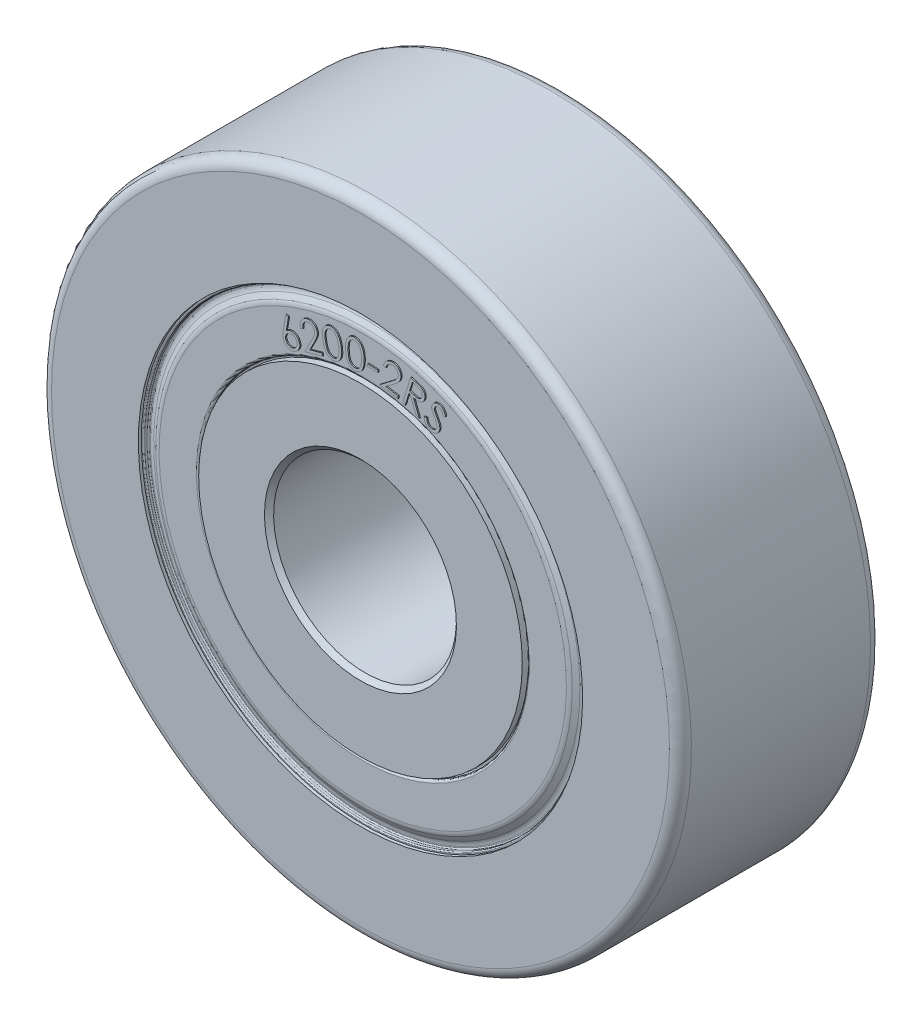
from build123d import *

# Parameters (mm, degrees)
WRAP1_DEPTH = 0.0625


# Read off the part's stored shape, not the designer's step: Wrap1
with BuildPart() as part:
    # Shield_RevolverSketch → ShieldsORseals (revolve)
    with BuildSketch(Plane(origin=(0, 0, 0), x_dir=(0, 0, -1), z_dir=(1, 0, 0))):
        with BuildLine():
            Line((-0.163675135, 12.15), (-10.836324865, 12.15))
            Line((-10.836324865, 12.15), (-10.836324865, 12.0875))
            ThreePointArc((-10.836324865, 12.0875), (-10.818019039, 12.043305826), (-10.773824865, 12.025))
            Line((-10.773824865, 12.025), (-10.648824865, 12.025))
            ThreePointArc((-10.648824865, 12.025), (-10.604630692, 12.006694174), (-10.586324865, 11.9625))
            Line((-10.586324865, 11.9625), (-10.586324865, 11.908974596))
            ThreePointArc((-10.586324865, 11.908974596), (-10.603361952, 11.779565074), (-10.653312164, 11.658974596))
            Line((-10.653312164, 11.658974596), (-10.808012702, 11.391025404))
            ThreePointArc((-10.808012702, 11.391025404), (-10.857962913, 11.270434926), (-10.875, 11.141025404))
            Line((-10.875, 11.141025404), (-10.875, 9.1))
            ThreePointArc((-10.875, 9.1), (-10.838388348, 9.011611652), (-10.75, 8.975))
            Line((-10.75, 8.975), (-10.6875, 8.975))
            ThreePointArc((-10.6875, 8.975), (-10.643305826, 8.956694174), (-10.625, 8.9125))
            Line((-10.625, 8.9125), (-10.625, 8.85))
            Line((-10.625, 8.85), (-0.375, 8.85))
            Line((-0.375, 8.85), (-0.375, 8.9125))
            ThreePointArc((-0.375, 8.9125), (-0.356694174, 8.956694174), (-0.3125, 8.975))
            Line((-0.3125, 8.975), (-0.25, 8.975))
            ThreePointArc((-0.25, 8.975), (-0.161611652, 9.011611652), (-0.125, 9.1))
            Line((-0.125, 9.1), (-0.125, 11.141025404))
            ThreePointArc((-0.125, 11.141025404), (-0.142037087, 11.270434926), (-0.191987298, 11.391025404))
            Line((-0.191987298, 11.391025404), (-0.346687836, 11.658974596))
            ThreePointArc((-0.346687836, 11.658974596), (-0.396638048, 11.779565074), (-0.413675135, 11.908974596))
            Line((-0.413675135, 11.908974596), (-0.413675135, 11.9625))
            ThreePointArc((-0.413675135, 11.9625), (-0.395369308, 12.006694174), (-0.351175135, 12.025))
            Line((-0.351175135, 12.025), (-0.226175135, 12.025))
            ThreePointArc((-0.226175135, 12.025), (-0.181980961, 12.043305826), (-0.163675135, 12.0875))
            Line((-0.163675135, 12.0875), (-0.163675135, 12.15))
        make_face()
    revolve(axis=Axis((0, 0, 0), (0, 0, 1)))

    # ProfileRevolveSketch → InnerANDouterRaces (revolve)
    with BuildSketch(Plane(origin=(0, 0, 0), x_dir=(0, 0, -1), z_dir=(1, 0, 0))):
        Polygon((0, 5.25), (0, 8.85), (-11, 8.85), (-11, 5.25), (-10.75, 5), (-0.25, 5), align=None)
        with BuildLine():
            Line((0, 16.9), (0, 12.15))
            Line((0, 12.15), (-11, 12.15))
            Line((-11, 12.15), (-11, 16.9))
            ThreePointArc((-11, 16.9), (-10.824264069, 17.324264069), (-10.4, 17.5))
            Line((-10.4, 17.5), (-0.6, 17.5))
            ThreePointArc((-0.6, 17.5), (-0.175735931, 17.324264069), (0, 16.9))
        make_face()
    revolve(axis=Axis((0, 0, 0), (0, 0, 1)))

    # Wrap1 outline → Wrap1 (add)
    # profile 1 of 8: a face of its own
    with BuildSketch(Plane.XY.offset(10.875)):
        with BuildLine():
            add(Edge.make_bspline(
                [(-4.119017386, 9.239939902), (-4.108541975, 9.249130369), (-4.088091496, 9.267072334), (-4.055801866, 9.290378365), (-4.023646891, 9.3106551), (-4.001340094, 9.321275332), (-3.990411617, 9.326478363)],
                knots=[0, 0, 0, 0, 0.268479265, 0.524135005, 0.76686569, 1, 1, 1, 1], degree=3))
            Line((-4.119017386, 9.239939902), (-3.996721713, 9.962295671))
            Line((-3.996721713, 9.962295671), (-4.141553443, 9.985733171))
            Line((-4.141553443, 9.985733171), (-4.283079886, 9.184050479))
            add(Edge.make_bspline(
                [(-4.262647193, 8.716802883), (-4.268465026, 8.731119106), (-4.280307463, 8.760260367), (-4.292560162, 8.806919743), (-4.301584618, 8.856339174), (-4.306052203, 8.89970612), (-4.307649663, 8.936440824), (-4.307592032, 8.966213451), (-4.306381974, 8.997885143), (-4.303823476, 9.031431011), (-4.300736213, 9.066944408), (-4.295617099, 9.104253744), (-4.290109079, 9.143566531), (-4.285460344, 9.170340466), (-4.283079886, 9.184050479)],
                knots=[0, 0, 0, 0, 0.097579587, 0.198627263, 0.304167428, 0.414903045, 0.47382958, 0.536499886, 0.603016605, 0.674096982, 0.749118783, 0.82826568, 0.912060748, 1, 1, 1, 1], degree=3))
            add(Edge.make_bspline(
                [(-3.66348854, 8.48152644), (-3.682244499, 8.473982697), (-3.719331193, 8.459066239), (-3.777798344, 8.446111896), (-3.836936919, 8.440209856), (-3.896453227, 8.442396392), (-3.955031206, 8.452135918), (-4.011392195, 8.470133646), (-4.065221626, 8.495545085), (-4.115350519, 8.528937494), (-4.161050724, 8.568526492), (-4.201828745, 8.612880142), (-4.236164814, 8.662496331), (-4.253782278, 8.698623889), (-4.262647193, 8.716802883)],
                knots=[0, 0, 0, 0, 0.084484254, 0.167053121, 0.249597513, 0.332646988, 0.415549289, 0.497345244, 0.579471351, 0.663876535, 0.748580962, 0.831959841, 0.915444023, 1, 1, 1, 1], degree=3))
            add(Edge.make_bspline(
                [(-3.42160152, 9.09090144), (-3.413794969, 9.071337992), (-3.398462834, 9.032915211), (-3.384226559, 8.97308677), (-3.378482917, 8.913030689), (-3.380875474, 8.853182034), (-3.391326524, 8.794506023), (-3.410055989, 8.73787444), (-3.436222623, 8.683425851), (-3.470631705, 8.63241958), (-3.510901998, 8.585425243), (-3.556607517, 8.543902079), (-3.607407191, 8.5084104), (-3.644679911, 8.490542814), (-3.66348854, 8.48152644)],
                knots=[0, 0, 0, 0, 0.086348144, 0.169588498, 0.251341229, 0.333197208, 0.414623848, 0.495076882, 0.577245943, 0.661714138, 0.746816905, 0.830615492, 0.914524877, 1, 1, 1, 1], degree=3))
            add(Edge.make_bspline(
                [(-3.990411617, 9.326478363), (-3.976986426, 9.331955464), (-3.950457086, 9.342778689), (-3.909452858, 9.354156277), (-3.868360688, 9.361106446), (-3.827182828, 9.363831115), (-3.785881704, 9.362384275), (-3.74447542, 9.35630767), (-3.703169635, 9.345602472), (-3.662211754, 9.330970979), (-3.622696324, 9.31253086), (-3.585260168, 9.290758749), (-3.550798732, 9.265499069), (-3.518964692, 9.23713988), (-3.490281936, 9.205308126), (-3.464500931, 9.170295156), (-3.440966892, 9.132230918), (-3.428144237, 9.104864873), (-3.42160152, 9.09090144)],
                knots=[0, 0, 0, 0, 0.06337709, 0.125238616, 0.185664134, 0.245373965, 0.305431523, 0.36608529, 0.428030524, 0.491771466, 0.556056566, 0.618494006, 0.680882246, 0.742621107, 0.804653029, 0.867913426, 0.932603269, 1, 1, 1, 1], degree=3))
        make_face()
        with BuildLine():
            add(Edge.make_bspline(
                [(-4.130435655, 8.777199517), (-4.125898776, 8.767596793), (-4.116942445, 8.748639885), (-4.100693458, 8.72203098), (-4.081853569, 8.698026827), (-4.061359565, 8.675768532), (-4.038459019, 8.655958433), (-4.013393573, 8.638420421), (-3.986118134, 8.623413461), (-3.957193696, 8.610568998), (-3.927147516, 8.600361768), (-3.896712887, 8.593500058), (-3.86643414, 8.589489743), (-3.836238543, 8.588621236), (-3.806004919, 8.590630648), (-3.775949486, 8.596211303), (-3.745862007, 8.604507423), (-3.726511622, 8.612618838), (-3.716673636, 8.616742787)],
                knots=[0, 0, 0, 0, 0.064495797, 0.127322289, 0.188910699, 0.249618039, 0.310868843, 0.372484302, 0.435133734, 0.499698388, 0.564546303, 0.627578736, 0.688941276, 0.74981916, 0.810818569, 0.872646997, 0.935252086, 1, 1, 1, 1], degree=3))
            add(Edge.make_bspline(
                [(-3.970279405, 9.19216346), (-3.979903574, 9.187659002), (-3.998950624, 9.178744296), (-4.025238567, 9.162023481), (-4.049670286, 9.143644442), (-4.071593959, 9.122755928), (-4.091529153, 9.099902906), (-4.109146753, 9.074766357), (-4.123979191, 9.047298872), (-4.136930526, 9.018328982), (-4.147055192, 8.988360057), (-4.15405999, 8.957953445), (-4.157933108, 8.927658775), (-4.158971283, 8.897351126), (-4.156442293, 8.86714576), (-4.15095775, 8.836984695), (-4.142670482, 8.806692556), (-4.134558615, 8.787138245), (-4.130435655, 8.777199517)],
                knots=[0, 0, 0, 0, 0.064360214, 0.127374345, 0.1884632, 0.249458427, 0.310580469, 0.372066399, 0.43511563, 0.499544555, 0.564256147, 0.62656415, 0.688399902, 0.749149808, 0.810066398, 0.871764849, 0.934822851, 1, 1, 1, 1], degree=3))
            add(Edge.make_bspline(
                [(-3.555916424, 9.030504806), (-3.560555027, 9.040208916), (-3.569655731, 9.059247892), (-3.5860633, 9.08598852), (-3.604681549, 9.11036553), (-3.625613024, 9.132428251), (-3.648480651, 9.152352911), (-3.673612694, 9.169975599), (-3.701083533, 9.184798023), (-3.730044409, 9.197785135), (-3.760067579, 9.20778477), (-3.79028425, 9.215243606), (-3.820526709, 9.21908199), (-3.850712846, 9.219994755), (-3.880946928, 9.217968115), (-3.911010145, 9.212412455), (-3.941030146, 9.204041453), (-3.960431866, 9.196162501), (-3.970279405, 9.19216346)],
                knots=[0, 0, 0, 0, 0.065209084, 0.127936942, 0.189909996, 0.250937757, 0.312092402, 0.373611129, 0.436693989, 0.501157281, 0.56590339, 0.628383614, 0.689649819, 0.750432129, 0.811335773, 0.873067135, 0.935573938, 1, 1, 1, 1], degree=3))
            add(Edge.make_bspline(
                [(-3.716673636, 8.616742787), (-3.70707133, 8.621280027), (-3.68811525, 8.630237072), (-3.661500302, 8.646480847), (-3.637518444, 8.665339964), (-3.615226425, 8.685718981), (-3.595758024, 8.708826749), (-3.578176046, 8.733769736), (-3.563200392, 8.761066167), (-3.550312982, 8.789976805), (-3.540238033, 8.820078029), (-3.53287672, 8.85041963), (-3.52899051, 8.880750319), (-3.528087104, 8.910938726), (-3.530111231, 8.941172198), (-3.535667575, 8.971235581), (-3.544038393, 9.001255538), (-3.55191737, 9.020657263), (-3.555916424, 9.030504806)],
                knots=[0, 0, 0, 0, 0.064526764, 0.127383421, 0.189001401, 0.24973789, 0.310620658, 0.3722657, 0.434945212, 0.499540866, 0.564419917, 0.627620577, 0.68901258, 0.749919694, 0.810948391, 0.872806505, 0.935441652, 1, 1, 1, 1], degree=3))
        make_face(mode=Mode.SUBTRACT)
    # profile 2 of 8: a face of its own
    with BuildSketch(Plane.XY.offset(10.875)):
        with BuildLine():
            add(Edge.make_bspline(
                [(-3.346730427, 9.746912009), (-3.350629817, 9.764485943), (-3.358290396, 9.799010967), (-3.364580499, 9.850905718), (-3.366170046, 9.901597198), (-3.362948997, 9.951035894), (-3.35463875, 9.999195689), (-3.34215358, 10.046178465), (-3.324524965, 10.091857785), (-3.302326568, 10.135741041), (-3.276384483, 10.177365873), (-3.246900172, 10.215624803), (-3.214210832, 10.25019628), (-3.178242712, 10.280985405), (-3.139098204, 10.3081218), (-3.096637308, 10.331293057), (-3.051237657, 10.351077569), (-3.019219529, 10.360714307), (-3.002980427, 10.365601912)],
                knots=[0, 0, 0, 0, 0.068457554, 0.13448887, 0.19853752, 0.26117395, 0.322631977, 0.384196242, 0.445837119, 0.508552326, 0.571041364, 0.632171259, 0.692013104, 0.751739571, 0.811992539, 0.872879646, 0.935526509, 1, 1, 1, 1], degree=3))
            Line((-3.346730427, 9.746912009), (-3.209110234, 9.784772585))
            add(Edge.make_bspline(
                [(-2.97293235, 10.226779797), (-2.984126211, 10.223388152), (-3.006064282, 10.216741101), (-3.037180465, 10.203275582), (-3.06629469, 10.187714178), (-3.092936218, 10.169289292), (-3.117630649, 10.148808702), (-3.139689534, 10.125405151), (-3.159373271, 10.099478729), (-3.177299286, 10.0716546), (-3.191963582, 10.041453299), (-3.203688598, 10.009528551), (-3.212383997, 9.976011775), (-3.218195752, 9.94092287), (-3.220428558, 9.904093577), (-3.219763202, 9.865628987), (-3.216209725, 9.825542145), (-3.211512269, 9.798566516), (-3.209110234, 9.784772585)],
                knots=[0, 0, 0, 0, 0.062862032, 0.123198936, 0.182013628, 0.24013843, 0.297110984, 0.354269154, 0.412667909, 0.471998421, 0.531988032, 0.592832622, 0.654635492, 0.717957484, 0.78382014, 0.852782271, 0.924720526, 1, 1, 1, 1], degree=3))
            add(Edge.make_bspline(
                [(-2.579603023, 10.01704422), (-2.58260272, 10.02693397), (-2.588494774, 10.046359584), (-2.600806868, 10.07400449), (-2.615371668, 10.099943799), (-2.63314943, 10.123761564), (-2.652860234, 10.146095481), (-2.675377705, 10.16638991), (-2.700417272, 10.184687067), (-2.727578071, 10.201039108), (-2.756116303, 10.215233531), (-2.785752661, 10.225871643), (-2.815609418, 10.234271524), (-2.84616396, 10.239098949), (-2.877273561, 10.240386333), (-2.908871913, 10.239364994), (-2.940972457, 10.234766627), (-2.962155928, 10.229472843), (-2.97293235, 10.226779797)],
                knots=[0, 0, 0, 0, 0.062477408, 0.122719172, 0.182704327, 0.242098784, 0.302190993, 0.362688278, 0.425112756, 0.489552191, 0.554329863, 0.617601705, 0.679790397, 0.741763149, 0.80425819, 0.867937953, 0.932817602, 1, 1, 1, 1], degree=3))
            add(Edge.make_bspline(
                [(-2.72293235, 9.495710085), (-2.713580812, 9.513820304), (-2.695597607, 9.548646639), (-2.67030608, 9.599058732), (-2.648015099, 9.64561872), (-2.628762942, 9.688335182), (-2.612285416, 9.727026023), (-2.598198754, 9.761656197), (-2.587309312, 9.792528046), (-2.576935354, 9.828330832), (-2.568349577, 9.870374928), (-2.564940364, 9.920083333), (-2.568415681, 9.969280829), (-2.575866866, 10.001093021), (-2.579603023, 10.01704422)],
                knots=[0, 0, 0, 0, 0.110286024, 0.212082361, 0.30516876, 0.389582524, 0.465584674, 0.532711281, 0.591844642, 0.642615695, 0.734341658, 0.823422933, 0.911461122, 1, 1, 1, 1], degree=3))
            Line((-2.72293235, 9.495710085), (-3.107547734, 8.750818259))
            Line((-3.107547734, 8.750818259), (-2.131886677, 9.021250951))
            Line((-2.131886677, 9.021250951), (-2.170348215, 9.160073066))
            Line((-2.170348215, 9.160073066), (-2.833509273, 8.976178835))
            Line((-2.833509273, 8.976178835), (-2.582908311, 9.460854316))
            add(Edge.make_bspline(
                [(-2.440480427, 10.058811047), (-2.435629487, 10.038574054), (-2.425992997, 9.998372858), (-2.421214365, 9.936565703), (-2.423903164, 9.874716278), (-2.432760789, 9.822817723), (-2.444509451, 9.779834187), (-2.45600014, 9.744066207), (-2.470202133, 9.705006303), (-2.487126045, 9.66251715), (-2.506841357, 9.61666681), (-2.53004235, 9.567739487), (-2.554949347, 9.515088295), (-2.573383709, 9.47932986), (-2.582908311, 9.460854316)],
                knots=[0, 0, 0, 0, 0.098850434, 0.196368386, 0.293644017, 0.392714598, 0.445985923, 0.505495044, 0.571347296, 0.643620285, 0.722998347, 0.808673567, 0.901146123, 1, 1, 1, 1], degree=3))
            add(Edge.make_bspline(
                [(-3.002980427, 10.365601912), (-2.986715027, 10.369694001), (-2.95493307, 10.377689783), (-2.907047099, 10.384649097), (-2.860437905, 10.386864863), (-2.815022215, 10.384115142), (-2.770919552, 10.376877949), (-2.72802877, 10.365217808), (-2.686459352, 10.348435463), (-2.646712609, 10.32713553), (-2.60897008, 10.302779652), (-2.574594625, 10.275237353), (-2.543483034, 10.245399192), (-2.515677487, 10.213194461), (-2.491467466, 10.178317157), (-2.470725221, 10.140987428), (-2.453358664, 10.101030183), (-2.444817354, 10.073028935), (-2.440480427, 10.058811047)],
                knots=[0, 0, 0, 0, 0.070287779, 0.137339586, 0.202498546, 0.265604683, 0.327740603, 0.389582061, 0.451578749, 0.515263522, 0.578396203, 0.63965313, 0.699649022, 0.758909938, 0.81774075, 0.877334045, 0.937715248, 1, 1, 1, 1], degree=3))
        make_face()
    # profile 3 of 8: a face of its own
    with BuildSketch(Plane.XY.offset(10.875)):
        with BuildLine():
            add(Edge.make_bspline(
                [(-1.755683856, 10.656285863), (-1.7438866, 10.65806529), (-1.720576299, 10.661581276), (-1.685491425, 10.663731953), (-1.650846237, 10.662644236), (-1.616569903, 10.659496583), (-1.582724909, 10.653369924), (-1.549203391, 10.644727862), (-1.516262912, 10.632848301), (-1.483671039, 10.618737481), (-1.451778334, 10.602000937), (-1.420966685, 10.5820006), (-1.391402004, 10.558990973), (-1.36217287, 10.533929176), (-1.335140292, 10.505029716), (-1.308437868, 10.474027455), (-1.282909102, 10.440021972), (-1.258621041, 10.402942026), (-1.235152088, 10.362717736), (-1.213683982, 10.318585413), (-1.193945128, 10.270508888), (-1.175267844, 10.218815154), (-1.158247654, 10.163132124), (-1.1425773, 10.103619498), (-1.128895671, 10.040094872), (-1.120944393, 9.996353448), (-1.116861741, 9.973894036)],
                knots=[0, 0, 0, 0, 0.034102655, 0.067383732, 0.100329197, 0.133128705, 0.1657112, 0.198566922, 0.231990626, 0.265722096, 0.300054853, 0.334847963, 0.370591044, 0.4071228, 0.44479738, 0.483594868, 0.52408973, 0.566267135, 0.610279189, 0.65715629, 0.706458592, 0.758819271, 0.814258235, 0.872885352, 0.934731888, 1, 1, 1, 1], degree=3))
            add(Edge.make_bspline(
                [(-2.116260779, 9.803220959), (-2.120119772, 9.826735853), (-2.127608449, 9.872368343), (-2.13598606, 9.939118914), (-2.141849231, 10.002050152), (-2.144805774, 10.061298451), (-2.145606604, 10.116739926), (-2.143562996, 10.168405881), (-2.138870797, 10.216290187), (-2.13137013, 10.26076104), (-2.121218253, 10.302202718), (-2.109635522, 10.341410694), (-2.095794389, 10.378466182), (-2.079906652, 10.413300429), (-2.062025242, 10.446030435), (-2.042343914, 10.476722054), (-2.020142904, 10.505116894), (-1.996264145, 10.531465303), (-1.970661665, 10.555475226), (-1.943859347, 10.577341973), (-1.915437682, 10.596432009), (-1.886185792, 10.613840827), (-1.855172257, 10.627786215), (-1.823321627, 10.639919669), (-1.79007998, 10.649689579), (-1.76724494, 10.654068747), (-1.755683856, 10.656285863)],
                knots=[0, 0, 0, 0, 0.068601712, 0.133126989, 0.193644809, 0.250526801, 0.303878329, 0.353230861, 0.39931322, 0.44231224, 0.482948854, 0.52208755, 0.559956334, 0.596733376, 0.632221611, 0.66725587, 0.701576721, 0.735872121, 0.769532424, 0.802544153, 0.835337263, 0.868030055, 0.900416177, 0.933087342, 0.966122993, 1, 1, 1, 1], degree=3))
            add(Edge.make_bspline(
                [(-1.493063664, 9.118425286), (-1.504663852, 9.116771228), (-1.527690377, 9.113487901), (-1.562251154, 9.11127151), (-1.596304283, 9.112345339), (-1.629965109, 9.115582224), (-1.663244961, 9.121558984), (-1.696036644, 9.130401991), (-1.728482539, 9.141478729), (-1.760215038, 9.155626987), (-1.791238943, 9.172534545), (-1.821303737, 9.191960228), (-1.849978534, 9.214481237), (-1.877650503, 9.239512448), (-1.904450911, 9.267052974), (-1.929663606, 9.29771151), (-1.954041095, 9.330743939), (-1.977382397, 9.36677536), (-1.999468352, 9.406470329), (-2.020132255, 9.450340716), (-2.039225176, 9.498730296), (-2.057520875, 9.551110198), (-2.074458976, 9.607939888), (-2.089406104, 9.669221388), (-2.10410441, 9.73465705), (-2.112134452, 9.779947799), (-2.116260779, 9.803220959)],
                knots=[0, 0, 0, 0, 0.033758538, 0.067011139, 0.099636562, 0.131830181, 0.164382755, 0.196936609, 0.229613057, 0.263079157, 0.296916565, 0.331339733, 0.366095245, 0.401857207, 0.438801548, 0.476716225, 0.516143083, 0.557051689, 0.600334896, 0.646942151, 0.696678475, 0.750167267, 0.806783666, 0.867473974, 0.931900014, 1, 1, 1, 1], degree=3))
            add(Edge.make_bspline(
                [(-1.116861741, 9.973894036), (-1.113194017, 9.951481932), (-1.106038855, 9.907759382), (-1.098291599, 9.843502332), (-1.093063531, 9.782367908), (-1.090617357, 9.724421394), (-1.090781832, 9.669660168), (-1.093881746, 9.61812468), (-1.098956795, 9.569585524), (-1.10758252, 9.524198236), (-1.118086726, 9.481448216), (-1.130800471, 9.441169661), (-1.145047491, 9.402912864), (-1.161701323, 9.367000451), (-1.180226326, 9.33325708), (-1.201139788, 9.301961454), (-1.223670478, 9.272598194), (-1.248308414, 9.245679197), (-1.274381335, 9.221022577), (-1.301908478, 9.198898502), (-1.330757364, 9.179489859), (-1.360681878, 9.162118088), (-1.391983672, 9.14743842), (-1.424537293, 9.135136038), (-1.458230137, 9.124985401), (-1.481396799, 9.120622479), (-1.493063664, 9.118425286)],
                knots=[0, 0, 0, 0, 0.064964172, 0.126735055, 0.185106669, 0.240456744, 0.292608155, 0.341690531, 0.388111202, 0.432116611, 0.473745143, 0.513983624, 0.552886897, 0.590451216, 0.627133055, 0.662895734, 0.698029556, 0.732917134, 0.767174173, 0.800602696, 0.833823024, 0.866556594, 0.899498944, 0.932600424, 0.966057181, 1, 1, 1, 1], degree=3))
        make_face()
        with BuildLine():
            add(Edge.make_bspline(
                [(-1.510792029, 9.251838748), (-1.494790343, 9.255383941), (-1.462992478, 9.262428798), (-1.41809344, 9.283126487), (-1.376172346, 9.310949408), (-1.344856946, 9.340652375), (-1.321246666, 9.367326733), (-1.305567803, 9.390044748), (-1.290832779, 9.414144385), (-1.278458488, 9.44036717), (-1.267251181, 9.468135129), (-1.257554521, 9.497708619), (-1.249863818, 9.529190047), (-1.24595393, 9.550894567), (-1.243965106, 9.561934902)],
                knots=[0, 0, 0, 0, 0.111975071, 0.222512065, 0.336286055, 0.45520674, 0.516964281, 0.579962791, 0.643961753, 0.710232843, 0.778255956, 0.848975469, 0.923179069, 1, 1, 1, 1], degree=3))
            add(Edge.make_bspline(
                [(-1.977138183, 9.823954132), (-1.973652902, 9.803899533), (-1.966908206, 9.765089986), (-1.955143763, 9.709079666), (-1.942569011, 9.657183998), (-1.929367222, 9.609273297), (-1.91558461, 9.56535651), (-1.901261235, 9.525271992), (-1.886098599, 9.489157364), (-1.869632786, 9.456934762), (-1.85242134, 9.427856443), (-1.834195913, 9.401283593), (-1.815470029, 9.376602929), (-1.79538568, 9.354196627), (-1.774533478, 9.333754916), (-1.752432454, 9.315678962), (-1.729503636, 9.299573346), (-1.697965565, 9.28152932), (-1.657537406, 9.264262013), (-1.608433843, 9.250834941), (-1.559113126, 9.246244201), (-1.526896285, 9.249974221), (-1.510792029, 9.251838748)],
                knots=[0, 0, 0, 0, 0.074004831, 0.143213726, 0.208045477, 0.268124962, 0.323870583, 0.375363211, 0.422846776, 0.466169423, 0.506828004, 0.545615272, 0.583273151, 0.619383112, 0.654922976, 0.689334784, 0.723077204, 0.756683752, 0.821285988, 0.882324669, 0.941177549, 1, 1, 1, 1], degree=3))
            add(Edge.make_bspline(
                [(-1.727138183, 10.518064709), (-1.74303768, 10.514514483), (-1.774855683, 10.507409786), (-1.819811588, 10.486554592), (-1.861856928, 10.458124951), (-1.893688039, 10.428331006), (-1.917156464, 10.4009978), (-1.933397291, 10.378352847), (-1.948101301, 10.354060319), (-1.961156286, 10.327928378), (-1.97232644, 10.300115035), (-1.982533907, 10.270723881), (-1.990372174, 10.239502746), (-1.997197692, 10.206359416), (-2.001994237, 10.170629605), (-2.004598944, 10.131591144), (-2.005139015, 10.08906484), (-2.003413548, 10.042868358), (-2.000311115, 9.993125209), (-1.994251147, 9.939867581), (-1.986914123, 9.883022715), (-1.980467078, 9.844068115), (-1.977138183, 9.823954132)],
                knots=[0, 0, 0, 0, 0.059113875, 0.118298428, 0.178923044, 0.243107793, 0.276181304, 0.309849384, 0.344337262, 0.379365432, 0.415964846, 0.453291347, 0.492434965, 0.532944854, 0.576326109, 0.623435567, 0.675171873, 0.730940147, 0.791547247, 0.856399507, 0.925852715, 1, 1, 1, 1], degree=3))
            add(Edge.make_bspline(
                [(-1.253580491, 9.947451729), (-1.256767409, 9.96540306), (-1.263000533, 10.000513116), (-1.274134942, 10.051627373), (-1.286509402, 10.099991357), (-1.299558465, 10.14567824), (-1.31400139, 10.188494055), (-1.329671844, 10.228445697), (-1.346087643, 10.265855766), (-1.363842704, 10.300419806), (-1.382484189, 10.332262878), (-1.401721282, 10.361648207), (-1.421933344, 10.388324802), (-1.442526837, 10.41297424), (-1.46451198, 10.434407224), (-1.486897686, 10.453614358), (-1.510016318, 10.470306075), (-1.541700616, 10.488172345), (-1.58151083, 10.506252761), (-1.630479327, 10.518797527), (-1.679305507, 10.524177519), (-1.711230051, 10.5200977), (-1.727138183, 10.518064709)],
                knots=[0, 0, 0, 0, 0.066330546, 0.12973239, 0.190276671, 0.247942696, 0.302566892, 0.354607626, 0.404041377, 0.451143349, 0.49589443, 0.538244111, 0.578840625, 0.617616752, 0.654981855, 0.690398208, 0.724881713, 0.758511233, 0.822634754, 0.883269996, 0.941832956, 1, 1, 1, 1], degree=3))
            add(Edge.make_bspline(
                [(-1.243965106, 9.561934902), (-1.2418084, 9.576037892), (-1.237431892, 9.604656455), (-1.233646149, 9.648708994), (-1.23198766, 9.694327643), (-1.231788829, 9.741654131), (-1.234476974, 9.790654956), (-1.23859539, 9.841476809), (-1.244871019, 9.894007347), (-1.250645599, 9.929442197), (-1.253580491, 9.947451729)],
                knots=[0, 0, 0, 0, 0.11045612, 0.224143636, 0.342128631, 0.463899877, 0.590476978, 0.722004576, 0.858710637, 1, 1, 1, 1], degree=3))
        make_face(mode=Mode.SUBTRACT)
    # profile 4 of 8: a face of its own
    with BuildSketch(Plane.XY.offset(10.875)):
        with BuildLine():
            add(Edge.make_bspline(
                [(-0.403103844, 10.792389239), (-0.391180971, 10.792453982), (-0.367501394, 10.792582566), (-0.332325777, 10.789869713), (-0.297870486, 10.784419518), (-0.264270662, 10.776396774), (-0.231465728, 10.76536781), (-0.199448736, 10.751868819), (-0.168030647, 10.735940722), (-0.137635033, 10.717185089), (-0.108159156, 10.695964197), (-0.080274276, 10.671780243), (-0.053549749, 10.645253506), (-0.028782965, 10.615706926), (-0.005162692, 10.583615785), (0.016996762, 10.548921789), (0.037360432, 10.511333788), (0.056861201, 10.471306497), (0.074122561, 10.427871279), (0.090013678, 10.381144918), (0.102877281, 10.330521946), (0.114422787, 10.276423933), (0.123501703, 10.21862029), (0.131196523, 10.157219083), (0.136079516, 10.092127609), (0.137987033, 10.047503377), (0.138963464, 10.024660874)],
                knots=[0, 0, 0, 0, 0.033911858, 0.067351088, 0.100239387, 0.13306961, 0.165510428, 0.1985883, 0.231851004, 0.26562249, 0.300107788, 0.335065509, 0.370529448, 0.407125912, 0.444628672, 0.483837833, 0.524137763, 0.566197647, 0.610435885, 0.657024591, 0.706513168, 0.758937165, 0.814358728, 0.872926188, 0.934952742, 1, 1, 1, 1], degree=3))
            add(Edge.make_bspline(
                [(-0.879365863, 9.992509431), (-0.879929048, 10.016446865), (-0.881022402, 10.062918387), (-0.879939072, 10.130553484), (-0.87755368, 10.194018619), (-0.872368018, 10.253358028), (-0.865293057, 10.308623079), (-0.856052836, 10.359796674), (-0.844709508, 10.40688835), (-0.831104423, 10.45010288), (-0.815650025, 10.49010576), (-0.798536607, 10.527463823), (-0.779610737, 10.562430993), (-0.758837558, 10.594907738), (-0.736560903, 10.625030774), (-0.712798282, 10.652990749), (-0.686862639, 10.678109077), (-0.659502021, 10.701099675), (-0.630672447, 10.721291585), (-0.601162549, 10.739630225), (-0.570448967, 10.754928141), (-0.538742762, 10.767523375), (-0.506249104, 10.777885552), (-0.472642666, 10.785284095), (-0.438213915, 10.790587473), (-0.414841345, 10.791786898), (-0.403103844, 10.792389239)],
                knots=[0, 0, 0, 0, 0.068596796, 0.133172067, 0.193778996, 0.250523315, 0.303774128, 0.353364491, 0.399441743, 0.442463219, 0.483073068, 0.522237628, 0.560119507, 0.596898328, 0.632598843, 0.667398713, 0.701897919, 0.735922394, 0.769683228, 0.80265922, 0.835385775, 0.867839415, 0.900332364, 0.932984599, 0.966345446, 1, 1, 1, 1], degree=3))
            add(Edge.make_bspline(
                [(-0.353524517, 9.225382027), (-0.365347124, 9.225316069), (-0.38872658, 9.225185635), (-0.423406623, 9.227888028), (-0.457131401, 9.233379993), (-0.490122807, 9.241157158), (-0.52237184, 9.251746184), (-0.553815003, 9.264924395), (-0.58443626, 9.280731578), (-0.614164366, 9.298978411), (-0.642669077, 9.320036815), (-0.669752679, 9.343579455), (-0.695601778, 9.369504946), (-0.71928683, 9.398548634), (-0.742575289, 9.429440611), (-0.763257796, 9.463659959), (-0.783262123, 9.499886803), (-0.801385369, 9.539152652), (-0.818091333, 9.581587145), (-0.832230689, 9.628205044), (-0.845425006, 9.678624997), (-0.855487254, 9.733534518), (-0.864728619, 9.792405957), (-0.871361419, 9.855499262), (-0.876573583, 9.922631421), (-0.878416961, 9.968762753), (-0.879365863, 9.992509431)],
                knots=[0, 0, 0, 0, 0.033899352, 0.067036684, 0.099624055, 0.131815223, 0.164156014, 0.196860931, 0.229495118, 0.262900331, 0.296799683, 0.33101284, 0.365749042, 0.401647739, 0.438419719, 0.476605333, 0.516199964, 0.557070447, 0.600548333, 0.646887416, 0.696704943, 0.749946512, 0.806907623, 0.867595559, 0.931843165, 1, 1, 1, 1], degree=3))
            add(Edge.make_bspline(
                [(0.138963464, 10.024660874), (0.139547274, 10.001825248), (0.140684178, 9.957355491), (0.139299379, 9.892312144), (0.136253701, 9.830846642), (0.130429207, 9.772814919), (0.122773257, 9.718349533), (0.112937958, 9.667246592), (0.100643911, 9.619791576), (0.086216689, 9.575616762), (0.069575139, 9.534680832), (0.051389484, 9.496332009), (0.032122791, 9.460113749), (0.010388717, 9.426804569), (-0.012949891, 9.396010458), (-0.037425425, 9.367291183), (-0.064077587, 9.341373914), (-0.092215495, 9.317961031), (-0.121802854, 9.297305053), (-0.152032892, 9.278763734), (-0.183548614, 9.263495272), (-0.215775668, 9.250552728), (-0.248832417, 9.23981316), (-0.282998946, 9.232541767), (-0.317911192, 9.227156028), (-0.34158569, 9.225976734), (-0.353524517, 9.225382027)],
                knots=[0, 0, 0, 0, 0.065034671, 0.126647547, 0.185196813, 0.240221887, 0.292654515, 0.341762897, 0.388316268, 0.432147454, 0.473985799, 0.514044404, 0.552966069, 0.59069933, 0.627147544, 0.662938209, 0.698030055, 0.732866007, 0.767047899, 0.800698598, 0.833733345, 0.866621267, 0.899542561, 0.932548981, 0.965985083, 1, 1, 1, 1], degree=3))
        make_face()
        with BuildLine():
            add(Edge.make_bspline(
                [(-0.352623074, 9.360297893), (-0.336297286, 9.361614427), (-0.303692721, 9.364243706), (-0.25632605, 9.378791683), (-0.210791635, 9.40067022), (-0.175467522, 9.425756909), (-0.148464395, 9.449276353), (-0.129620457, 9.469627195), (-0.111726882, 9.491555641), (-0.095485859, 9.515719209), (-0.0808653, 9.541961804), (-0.067295494, 9.570040549), (-0.054853289, 9.600080782), (-0.048087099, 9.621162142), (-0.044630286, 9.631932508)],
                knots=[0, 0, 0, 0, 0.111497695, 0.222674327, 0.335794649, 0.455075512, 0.517066108, 0.579932437, 0.644093597, 0.710071575, 0.778326161, 0.848949436, 0.922828991, 1, 1, 1, 1], degree=3))
            add(Edge.make_bspline(
                [(-0.738139901, 9.994011835), (-0.737342368, 9.973573794), (-0.735797125, 9.933974504), (-0.731861221, 9.876665219), (-0.726897769, 9.823227716), (-0.720263321, 9.773730683), (-0.712551191, 9.728002689), (-0.703559361, 9.686188243), (-0.693555122, 9.64816455), (-0.68163298, 9.613931304), (-0.668705344, 9.582557397), (-0.654047611, 9.553768154), (-0.638967199, 9.52649338), (-0.621918088, 9.501570285), (-0.604028885, 9.478234719), (-0.58440981, 9.457335694), (-0.56384465, 9.438100609), (-0.535045367, 9.415773423), (-0.497460614, 9.392471642), (-0.44999532, 9.373150943), (-0.401601616, 9.36119632), (-0.368915833, 9.360596755), (-0.352623074, 9.360297893)],
                knots=[0, 0, 0, 0, 0.073994186, 0.143365862, 0.207799461, 0.268118668, 0.323997988, 0.375526371, 0.422817319, 0.466134612, 0.506580032, 0.545473031, 0.582958019, 0.619239699, 0.654612452, 0.689227236, 0.722817824, 0.75637908, 0.82095009, 0.882051172, 0.941206491, 1, 1, 1, 1], degree=3))
            add(Edge.make_bspline(
                [(-0.393488459, 10.650261835), (-0.409912161, 10.648947014), (-0.442613156, 10.646329094), (-0.490385759, 10.631767552), (-0.536181213, 10.609198119), (-0.572112773, 10.583880883), (-0.599061565, 10.559684584), (-0.618315498, 10.539465115), (-0.636473482, 10.517502745), (-0.653045516, 10.493358721), (-0.667844023, 10.467153823), (-0.681928958, 10.439417197), (-0.69409219, 10.409487247), (-0.7053875, 10.377471667), (-0.715044848, 10.342446817), (-0.723178836, 10.303929946), (-0.729156282, 10.261532786), (-0.73446939, 10.215467763), (-0.737545018, 10.165522692), (-0.739324661, 10.11171633), (-0.739628148, 10.054100015), (-0.738645934, 10.014442984), (-0.738139901, 9.994011835)],
                knots=[0, 0, 0, 0, 0.059488334, 0.118446354, 0.179404296, 0.243669947, 0.276785102, 0.310373074, 0.34462737, 0.379820209, 0.416195528, 0.453482444, 0.492326305, 0.533025429, 0.576297315, 0.62371897, 0.675395917, 0.73120045, 0.791508202, 0.856432984, 0.926034829, 1, 1, 1, 1], degree=3))
            add(Edge.make_bspline(
                [(-0.001060574, 10.017148854), (-0.001705298, 10.035487268), (-0.002964432, 10.071301863), (-0.007438804, 10.123680347), (-0.012644082, 10.173515441), (-0.019543891, 10.220733279), (-0.027947424, 10.265347771), (-0.037788839, 10.307381949), (-0.049149994, 10.346824009), (-0.062126266, 10.38359405), (-0.076311709, 10.41782509), (-0.091162033, 10.44992841), (-0.107809346, 10.479286065), (-0.125126819, 10.506372347), (-0.143516714, 10.531057569), (-0.163424785, 10.55288361), (-0.184175612, 10.572658722), (-0.213054627, 10.595032436), (-0.250484565, 10.617751532), (-0.29702825, 10.638025202), (-0.34507292, 10.649201229), (-0.377410026, 10.649909616), (-0.393488459, 10.650261835)],
                knots=[0, 0, 0, 0, 0.066460546, 0.129796266, 0.190378406, 0.247950078, 0.302600854, 0.354788533, 0.404278033, 0.45121177, 0.495951302, 0.53847474, 0.579248683, 0.618096473, 0.654887086, 0.690593649, 0.72498755, 0.758591571, 0.822746118, 0.883060392, 0.941856095, 1, 1, 1, 1], degree=3))
            add(Edge.make_bspline(
                [(-0.044630286, 9.631932508), (-0.040564616, 9.645612485), (-0.032282289, 9.673480471), (-0.022651743, 9.716896662), (-0.014053115, 9.762143269), (-0.007917277, 9.80941177), (-0.003377765, 9.858523639), (-0.000747187, 9.909644816), (0.000213668, 9.962764365), (-0.000631135, 9.998820435), (-0.001060574, 10.017148854)],
                knots=[0, 0, 0, 0, 0.109899103, 0.223879522, 0.342366621, 0.464575695, 0.59086655, 0.722210419, 0.85879094, 1, 1, 1, 1], degree=3))
        make_face(mode=Mode.SUBTRACT)
    # profile 5 of 8: a face of its own
    with BuildSketch(Plane.XY.offset(10.875)):
        with BuildLine():
            add(Edge.make_bspline(
                [(1.194931548, 10.233579454), (1.198942564, 10.251087214), (1.206824559, 10.285491487), (1.223497468, 10.33484693), (1.243628031, 10.381191676), (1.267754731, 10.424402276), (1.295795502, 10.464334128), (1.327152026, 10.501397383), (1.362641741, 10.534887443), (1.401461534, 10.564948927), (1.442631297, 10.591348017), (1.485569594, 10.613050969), (1.529664484, 10.630439233), (1.575222262, 10.642735152), (1.622052594, 10.650325482), (1.670064747, 10.652828619), (1.719400796, 10.651275243), (1.752358215, 10.646280545), (1.769150298, 10.643735704)],
                knots=[0, 0, 0, 0, 0.068502145, 0.134612677, 0.198449186, 0.261074031, 0.323100062, 0.384370243, 0.446008844, 0.508926895, 0.571480558, 0.632329698, 0.692231652, 0.752032321, 0.812037822, 0.872903764, 0.935243395, 1, 1, 1, 1], degree=3))
            Line((1.194931548, 10.233579454), (1.335256067, 10.208940031))
            add(Edge.make_bspline(
                [(1.736998855, 10.506115512), (1.725504511, 10.507853048), (1.702902626, 10.511269649), (1.669068147, 10.512288721), (1.636289241, 10.510550946), (1.604298515, 10.505852005), (1.573437366, 10.497311037), (1.543467804, 10.485799822), (1.514415509, 10.471319144), (1.486560508, 10.453562021), (1.460137224, 10.432989409), (1.435913365, 10.409177573), (1.41362284, 10.382819177), (1.393838648, 10.353318396), (1.375658114, 10.321368669), (1.359788435, 10.286474475), (1.346300597, 10.248706995), (1.33899751, 10.222411481), (1.335256067, 10.208940031)],
                knots=[0, 0, 0, 0, 0.062645326, 0.12318253, 0.182149797, 0.239521975, 0.29717825, 0.354458812, 0.412435549, 0.471927462, 0.532331975, 0.592685746, 0.654793134, 0.718167794, 0.783961742, 0.852851485, 0.92461437, 1, 1, 1, 1], degree=3))
            add(Edge.make_bspline(
                [(2.001722413, 10.149144358), (2.003271736, 10.159339036), (2.006328116, 10.179450278), (2.006580293, 10.209678073), (2.004762685, 10.239304597), (1.999180394, 10.268297002), (1.990722464, 10.296677568), (1.979290839, 10.324548231), (1.964341579, 10.351522099), (1.947079724, 10.377833562), (1.927405668, 10.402706744), (1.905487161, 10.425182313), (1.881831208, 10.445185023), (1.856508404, 10.462852674), (1.829026422, 10.477385), (1.800062542, 10.489894296), (1.769217078, 10.499535867), (1.747860416, 10.503897351), (1.736998855, 10.506115512)],
                knots=[0, 0, 0, 0, 0.062526872, 0.123347994, 0.183092605, 0.242486496, 0.302128897, 0.362657491, 0.424971102, 0.489060401, 0.55354371, 0.617187195, 0.679319553, 0.741392369, 0.804240718, 0.8677184, 0.932724289, 1, 1, 1, 1], degree=3))
            add(Edge.make_bspline(
                [(1.649558952, 9.740790993), (1.665711983, 9.753075286), (1.696744885, 9.77667564), (1.741002709, 9.811228502), (1.780925371, 9.843528155), (1.816402639, 9.873794616), (1.848138362, 9.901131262), (1.875089627, 9.926906918), (1.898472193, 9.949748866), (1.923115033, 9.977696811), (1.948876828, 10.011945712), (1.973172702, 10.055358391), (1.991347047, 10.101152995), (1.998252683, 10.133095086), (2.001722413, 10.149144358)],
                knots=[0, 0, 0, 0, 0.110104805, 0.211531287, 0.304636916, 0.388692504, 0.464558029, 0.531832444, 0.591009781, 0.641826283, 0.73388564, 0.822931504, 0.91103211, 1, 1, 1, 1], degree=3))
            Line((1.649558952, 9.740790993), (0.984595009, 9.234180416))
            Line((0.984595009, 9.234180416), (1.978885875, 9.060502531))
            Line((1.978885875, 9.060502531), (2.003525298, 9.201728493))
            Line((2.003525298, 9.201728493), (1.327744048, 9.319817435))
            Line((1.327744048, 9.319817435), (1.760436355, 9.649444839))
            add(Edge.make_bspline(
                [(2.144450779, 10.127209262), (2.14015098, 10.106840896), (2.131631222, 10.066482364), (2.109938281, 10.008507105), (2.080679161, 9.954116582), (2.050648688, 9.911029358), (2.021771866, 9.877258001), (1.996163969, 9.849827214), (1.966329217, 9.82093594), (1.932933874, 9.789790477), (1.89542442, 9.757277639), (1.854005341, 9.722871922), (1.808744426, 9.686582811), (1.776907642, 9.66210753), (1.760436355, 9.649444839)],
                knots=[0, 0, 0, 0, 0.099159196, 0.196477199, 0.293905297, 0.393010422, 0.446211747, 0.50568257, 0.571876435, 0.644196047, 0.723403815, 0.808523203, 0.900936311, 1, 1, 1, 1], degree=3))
            add(Edge.make_bspline(
                [(1.769150298, 10.643735704), (1.785551933, 10.640546789), (1.817729244, 10.63429066), (1.86378971, 10.619705706), (1.906645034, 10.601529293), (1.946794303, 10.580400579), (1.983110007, 10.554470372), (2.016769947, 10.525641873), (2.04706246, 10.492832957), (2.073732411, 10.456677079), (2.097027766, 10.41853711), (2.116361027, 10.379187582), (2.131979984, 10.339174304), (2.142608387, 10.298080642), (2.149732495, 10.256366723), (2.152318758, 10.213881722), (2.150981002, 10.170578094), (2.146648134, 10.141802445), (2.144450779, 10.127209262)],
                knots=[0, 0, 0, 0, 0.070250619, 0.137820166, 0.202778429, 0.265936352, 0.328246575, 0.390086255, 0.452107996, 0.515652708, 0.578814848, 0.639872896, 0.699895613, 0.759177152, 0.818129802, 0.877665391, 0.937959653, 1, 1, 1, 1], degree=3))
        make_face()
    # profile 6 of 8: a face of its own
    with BuildSketch(Plane.XY.offset(10.875)):
        with BuildLine():
            add(Edge.make_bspline(
                [(2.959856499, 10.340310324), (2.978810491, 10.334576583), (3.015106606, 10.323596706), (3.066824233, 10.306645561), (3.113720496, 10.290770836), (3.155728929, 10.275840117), (3.192719665, 10.261762855), (3.224742744, 10.248572969), (3.251795256, 10.236181203), (3.267790335, 10.227410148), (3.275060826, 10.223423304)],
                knots=[0, 0, 0, 0, 0.17643377, 0.337863419, 0.484898708, 0.617568727, 0.735079086, 0.837503271, 0.926137851, 1, 1, 1, 1], degree=3))
            Line((2.959856499, 10.340310324), (2.676503133, 10.426548304))
            Line((2.676503133, 10.426548304), (2.244111307, 9.003771862))
            Line((2.244111307, 9.003771862), (2.38623871, 8.960502631))
            Line((2.38623871, 8.960502631), (2.587260345, 9.622161285))
            Line((2.587260345, 9.622161285), (2.668390153, 9.597521862))
            Line((2.668390153, 9.597521862), (2.978185826, 8.780815131))
            Line((2.978185826, 8.780815131), (3.154267557, 8.727329554))
            Line((3.154267557, 8.727329554), (2.843570441, 9.544336766))
            add(Edge.make_bspline(
                [(3.451142557, 9.777810324), (3.444835226, 9.759174799), (3.432530257, 9.722818763), (3.405897742, 9.672660172), (3.373622299, 9.628039533), (3.335519593, 9.589507263), (3.292799679, 9.556832363), (3.244871582, 9.532335866), (3.193259091, 9.513820151), (3.146959301, 9.505366628), (3.107643093, 9.502133142), (3.075825993, 9.502048667), (3.041998141, 9.503395916), (3.006211537, 9.507522018), (2.968318398, 9.513547854), (2.928427271, 9.521702676), (2.886533648, 9.531944957), (2.858165801, 9.540127049), (2.843570441, 9.544336766)],
                knots=[0, 0, 0, 0, 0.079650777, 0.155390667, 0.229216911, 0.302146652, 0.374341356, 0.446261494, 0.519462014, 0.595912563, 0.636241896, 0.679284414, 0.724806573, 0.773413211, 0.825215187, 0.880320532, 0.938424481, 1, 1, 1, 1], degree=3))
            add(Edge.make_bspline(
                [(3.275060826, 10.223423304), (3.284557616, 10.217640708), (3.303365489, 10.206188592), (3.329789679, 10.187021771), (3.354028738, 10.16603607), (3.376368149, 10.143625966), (3.396189723, 10.119122256), (3.413919405, 10.09311307), (3.430081786, 10.065787763), (3.443366485, 10.036694095), (3.454619402, 10.006620231), (3.463022203, 9.975750982), (3.468508366, 9.944167803), (3.470897279, 9.912063751), (3.470160692, 9.879295125), (3.466912608, 9.845916867), (3.460551806, 9.81186455), (3.454313784, 9.789287722), (3.451142557, 9.777810324)],
                knots=[0, 0, 0, 0, 0.064100638, 0.126947809, 0.187966297, 0.248820549, 0.309168362, 0.369405517, 0.430229612, 0.491989852, 0.553574295, 0.615223706, 0.676184761, 0.738157992, 0.800547001, 0.864972083, 0.931355758, 1, 1, 1, 1], degree=3))
        make_face()
        with BuildLine():
            add(Edge.make_bspline(
                [(2.873318037, 9.684060324), (2.884828878, 9.680730264), (2.90709863, 9.674287675), (2.939552056, 9.66533857), (2.970080503, 9.658568273), (2.998519029, 9.653052973), (3.024767378, 9.648996983), (3.049066932, 9.647041802), (3.071231858, 9.645843242), (3.097858883, 9.647101287), (3.128717399, 9.652186755), (3.163621961, 9.66292339), (3.195802191, 9.679477781), (3.22519248, 9.700854993), (3.251330582, 9.726358696), (3.273397048, 9.755405503), (3.291251097, 9.787689806), (3.29924253, 9.811019662), (3.303306018, 9.822882439)],
                knots=[0, 0, 0, 0, 0.069788801, 0.135018756, 0.196011041, 0.251839156, 0.303728217, 0.350571942, 0.393772917, 0.432894368, 0.505584754, 0.575319903, 0.64471266, 0.715303755, 0.786253042, 0.856602717, 0.927085275, 1, 1, 1, 1], degree=3))
            Line((2.873318037, 9.684060324), (2.629327653, 9.760382439))
            Line((2.629327653, 9.760382439), (2.776262749, 10.243855997))
            Line((2.776262749, 10.243855997), (3.02686371, 10.167834362))
            add(Edge.make_bspline(
                [(3.303306018, 9.822882439), (3.306520613, 9.834726542), (3.312847066, 9.858036219), (3.315175702, 9.894103802), (3.312957693, 9.929842427), (3.304960967, 9.964913436), (3.292629709, 9.99828346), (3.275522008, 10.02892387), (3.253993355, 10.056173217), (3.232365087, 10.076163265), (3.212338354, 10.091014693), (3.194269407, 10.102119065), (3.17306818, 10.11269953), (3.149393989, 10.123887554), (3.122822141, 10.135001213), (3.09341891, 10.146010481), (3.061178094, 10.157202834), (3.038604646, 10.164196701), (3.02686371, 10.167834362)],
                knots=[0, 0, 0, 0, 0.072836755, 0.143345695, 0.213811829, 0.285221239, 0.356488832, 0.42477523, 0.493074621, 0.562213437, 0.599273145, 0.641271969, 0.688170402, 0.740145457, 0.797022016, 0.859433617, 0.926888402, 1, 1, 1, 1], degree=3))
        make_face(mode=Mode.SUBTRACT)
    # profile 7 of 8: a face of its own
    with BuildSketch(Plane.XY.offset(10.875)):
        with BuildLine():
            add(Edge.make_bspline(
                [(3.559673942, 8.956550208), (3.562007459, 8.934262633), (3.566481488, 8.891530885), (3.578784678, 8.830960738), (3.595119843, 8.776800845), (3.615714839, 8.729054514), (3.64103887, 8.687927947), (3.670888883, 8.653503289), (3.704793214, 8.624853439), (3.730841338, 8.611811025), (3.743868654, 8.605288189)],
                knots=[0, 0, 0, 0, 0.161346606, 0.309348259, 0.444450171, 0.568177572, 0.68289133, 0.790806001, 0.895376874, 1, 1, 1, 1], degree=3))
            Line((3.559673942, 8.956550208), (3.413039327, 8.9379204))
            add(Edge.make_bspline(
                [(3.698195577, 8.466766554), (3.688013484, 8.471542903), (3.667919932, 8.48096865), (3.639112744, 8.497310772), (3.612182515, 8.515626087), (3.586761084, 8.535689151), (3.562656955, 8.557070291), (3.540793544, 8.580796437), (3.520108968, 8.605825226), (3.501170032, 8.632919892), (3.483931886, 8.662228134), (3.468626293, 8.694043074), (3.454753365, 8.728330197), (3.442851649, 8.765315366), (3.432609984, 8.804842243), (3.424292167, 8.846890427), (3.417683979, 8.891526729), (3.414615123, 8.922180365), (3.413039327, 8.9379204)],
                knots=[0, 0, 0, 0, 0.057988733, 0.11443617, 0.170599259, 0.22578219, 0.28137942, 0.336564768, 0.391991355, 0.448740526, 0.506857959, 0.567156677, 0.630658304, 0.69747098, 0.767382872, 0.841133986, 0.918425449, 1, 1, 1, 1], degree=3))
            add(Edge.make_bspline(
                [(4.248075385, 8.664182419), (4.242441616, 8.652113302), (4.231277538, 8.628196702), (4.209844684, 8.595257476), (4.186246648, 8.564468363), (4.158777359, 8.537223838), (4.129079607, 8.512033587), (4.096039124, 8.489917768), (4.059745444, 8.471249817), (4.02140968, 8.454702476), (3.981385765, 8.441802614), (3.940791097, 8.433181185), (3.900265705, 8.428183454), (3.859672703, 8.427602006), (3.819121388, 8.431287501), (3.778469428, 8.438878954), (3.737889782, 8.450514595), (3.711526383, 8.461308535), (3.698195577, 8.466766554)],
                knots=[0, 0, 0, 0, 0.061508056, 0.121886589, 0.181265935, 0.240535031, 0.30036052, 0.361110835, 0.423873424, 0.488813996, 0.553983665, 0.617925911, 0.680419708, 0.742479635, 0.805242224, 0.868365952, 0.933438477, 1, 1, 1, 1], degree=3))
            add(Edge.make_bspline(
                [(4.132089808, 9.239302612), (4.141721977, 9.222339357), (4.160379901, 9.18948081), (4.18557592, 9.14069316), (4.207871705, 9.094423522), (4.227265426, 9.050622466), (4.243137797, 9.009146383), (4.256258769, 8.970201203), (4.266312746, 8.933718804), (4.272951624, 8.899224875), (4.27721604, 8.866504946), (4.27935815, 8.834890969), (4.279397785, 8.804270122), (4.277293119, 8.7744414), (4.273045917, 8.745548478), (4.267186083, 8.717336051), (4.258679063, 8.690267362), (4.251599289, 8.67285119), (4.248075385, 8.664182419)],
                knots=[0, 0, 0, 0, 0.096027975, 0.186010276, 0.270259693, 0.348865458, 0.421759244, 0.488809962, 0.551130074, 0.607896568, 0.661596944, 0.71348737, 0.763783567, 0.812230482, 0.860556795, 0.907463537, 0.953940662, 1, 1, 1, 1], degree=3))
            add(Edge.make_bspline(
                [(4.015503269, 9.453845881), (4.017154304, 9.449915224), (4.021113658, 9.440489099), (4.02960124, 9.424733815), (4.03988695, 9.404234525), (4.053227075, 9.379651271), (4.069207628, 9.350735961), (4.087824475, 9.317530806), (4.108845556, 9.27975024), (4.124042623, 9.253305624), (4.132089808, 9.239302612)],
                knots=[0, 0, 0, 0, 0.052337877, 0.125511696, 0.219596097, 0.334077714, 0.468980014, 0.625390068, 0.801635713, 1, 1, 1, 1], degree=3))
            add(Edge.make_bspline(
                [(4.007690769, 9.669591073), (4.004595243, 9.662043279), (3.998472305, 9.647113773), (3.992610244, 9.623431277), (3.988578457, 9.599329017), (3.987371553, 9.574123817), (3.98919425, 9.54737049), (3.995045708, 9.518511264), (4.003294099, 9.486764432), (4.01129245, 9.465199157), (4.015503269, 9.453845881)],
                knots=[0, 0, 0, 0, 0.110015287, 0.217609773, 0.328560461, 0.439593548, 0.557536523, 0.689634649, 0.836604762, 1, 1, 1, 1], degree=3))
            add(Edge.make_bspline(
                [(4.271813365, 9.760636746), (4.258343555, 9.765857392), (4.232361784, 9.775927438), (4.191809732, 9.782290125), (4.152237746, 9.780971545), (4.114453335, 9.771214649), (4.079976864, 9.754694621), (4.049586403, 9.732498814), (4.025098131, 9.703582483), (4.013570531, 9.681072503), (4.007690769, 9.669591073)],
                knots=[0, 0, 0, 0, 0.138589545, 0.26732387, 0.391663205, 0.516872394, 0.639650105, 0.757347374, 0.876232722, 1, 1, 1, 1], degree=3))
            add(Edge.make_bspline(
                [(4.448195577, 9.482692035), (4.44556571, 9.493629171), (4.44048127, 9.514774434), (4.431913761, 9.545060049), (4.423762023, 9.573168348), (4.414592336, 9.598504163), (4.405871316, 9.621582022), (4.395945593, 9.641714168), (4.386649433, 9.659812018), (4.373378687, 9.680194337), (4.355045416, 9.702338454), (4.330584461, 9.725869715), (4.302728837, 9.745658905), (4.282187788, 9.755610575), (4.271813365, 9.760636746)],
                knots=[0, 0, 0, 0, 0.098320799, 0.190088085, 0.275126033, 0.354048298, 0.425587818, 0.49059807, 0.550136417, 0.603322871, 0.702875682, 0.80072754, 0.899355841, 1, 1, 1, 1], degree=3))
            Line((4.448195577, 9.482692035), (4.597234038, 9.518449246))
            add(Edge.make_bspline(
                [(4.337017692, 9.900360304), (4.352691049, 9.892887689), (4.383713427, 9.878097095), (4.425805538, 9.848194226), (4.463962635, 9.813486651), (4.492151057, 9.780040636), (4.512529452, 9.75004319), (4.527160245, 9.724831867), (4.541108002, 9.696976895), (4.553853965, 9.666391584), (4.565843534, 9.63315802), (4.577305457, 9.597413433), (4.587746669, 9.558872156), (4.594008876, 9.532190721), (4.597234038, 9.518449246)],
                knots=[0, 0, 0, 0, 0.107897204, 0.213561641, 0.31990613, 0.428299234, 0.484839179, 0.545462221, 0.609583749, 0.678589017, 0.751555148, 0.829429226, 0.912152626, 1, 1, 1, 1], degree=3))
            add(Edge.make_bspline(
                [(3.863760481, 9.726081458), (3.870689667, 9.740421956), (3.884361795, 9.768717503), (3.911315692, 9.806980326), (3.942037195, 9.841503758), (3.977609046, 9.870717648), (4.01646183, 9.895325089), (4.058386378, 9.913977171), (4.102988999, 9.926736535), (4.149574552, 9.933545408), (4.197308283, 9.934311638), (4.24489489, 9.929699682), (4.291894532, 9.918459629), (4.321824955, 9.906454254), (4.337017692, 9.900360304)],
                knots=[0, 0, 0, 0, 0.08479289, 0.167306676, 0.248601734, 0.330517128, 0.411863038, 0.493144063, 0.574275826, 0.65848652, 0.743413843, 0.828223548, 0.912805961, 1, 1, 1, 1], degree=3))
            add(Edge.make_bspline(
                [(3.844229231, 9.485095881), (3.841926061, 9.495679696), (3.837370377, 9.516614546), (3.834103783, 9.548127035), (3.832319744, 9.579129363), (3.833495188, 9.609623016), (3.837641356, 9.639606704), (3.843448405, 9.669130564), (3.852207013, 9.69807914), (3.85989996, 9.716724653), (3.863760481, 9.726081458)],
                knots=[0, 0, 0, 0, 0.131922459, 0.260943412, 0.385616992, 0.510236766, 0.632135916, 0.754242741, 0.876672592, 1, 1, 1, 1], degree=3))
            add(Edge.make_bspline(
                [(3.974337404, 9.204146362), (3.96525254, 9.220534705), (3.947934636, 9.251774769), (3.924244563, 9.297084541), (3.903109701, 9.338004503), (3.885309717, 9.375095641), (3.870533411, 9.408142097), (3.858620232, 9.437207494), (3.850120754, 9.462446738), (3.846058475, 9.478063606), (3.844229231, 9.485095881)],
                knots=[0, 0, 0, 0, 0.181111272, 0.345240987, 0.494186091, 0.626257698, 0.742840705, 0.84405605, 0.929778447, 1, 1, 1, 1], degree=3))
            add(Edge.make_bspline(
                [(4.112258077, 8.881430016), (4.109879884, 8.891879242), (4.104899283, 8.913762842), (4.094421235, 8.947639656), (4.081110431, 8.984022549), (4.065560414, 9.023228393), (4.046772117, 9.064764939), (4.024971996, 9.108770278), (4.001074871, 9.155837428), (3.983454147, 9.18767434), (3.974337404, 9.204146362)],
                knots=[0, 0, 0, 0, 0.091268481, 0.191141715, 0.301804558, 0.421275194, 0.550365239, 0.690034071, 0.839627495, 1, 1, 1, 1], degree=3))
            add(Edge.make_bspline(
                [(4.099036923, 8.726381939), (4.103579799, 8.738076103), (4.112768033, 8.761728237), (4.118604828, 8.800068426), (4.119114582, 8.840397089), (4.114594737, 8.867446217), (4.112258077, 8.881430016)],
                knots=[0, 0, 0, 0, 0.2375152, 0.480388447, 0.731372377, 1, 1, 1, 1], degree=3))
            add(Edge.make_bspline(
                [(3.743868654, 8.605288189), (3.755385267, 8.600667626), (3.778191645, 8.591517514), (3.814036095, 8.583365231), (3.850411547, 8.578829021), (3.887050399, 8.579726306), (3.922944371, 8.5841987), (3.956896043, 8.593642322), (3.98848507, 8.607226003), (4.017357938, 8.625026597), (4.043203358, 8.646323067), (4.065476254, 8.67065286), (4.084881098, 8.69703185), (4.094318113, 8.716598158), (4.099036923, 8.726381939)],
                knots=[0, 0, 0, 0, 0.089062813, 0.176371317, 0.263346764, 0.351907711, 0.43906174, 0.522723507, 0.604302654, 0.685423095, 0.765708676, 0.844162629, 0.922076326, 1, 1, 1, 1], degree=3))
        make_face()
    # profile 8 of 8: a face of its own
    with BuildSketch(Plane.XY.offset(10.875)):
        Polygon((0.887077558, 9.753189695), (0.893688134, 9.876687291), (0.335695346, 9.906735368), (0.329084769, 9.783237772), align=None)
    extrude(amount=WRAP1_DEPTH)


solid = part.part
